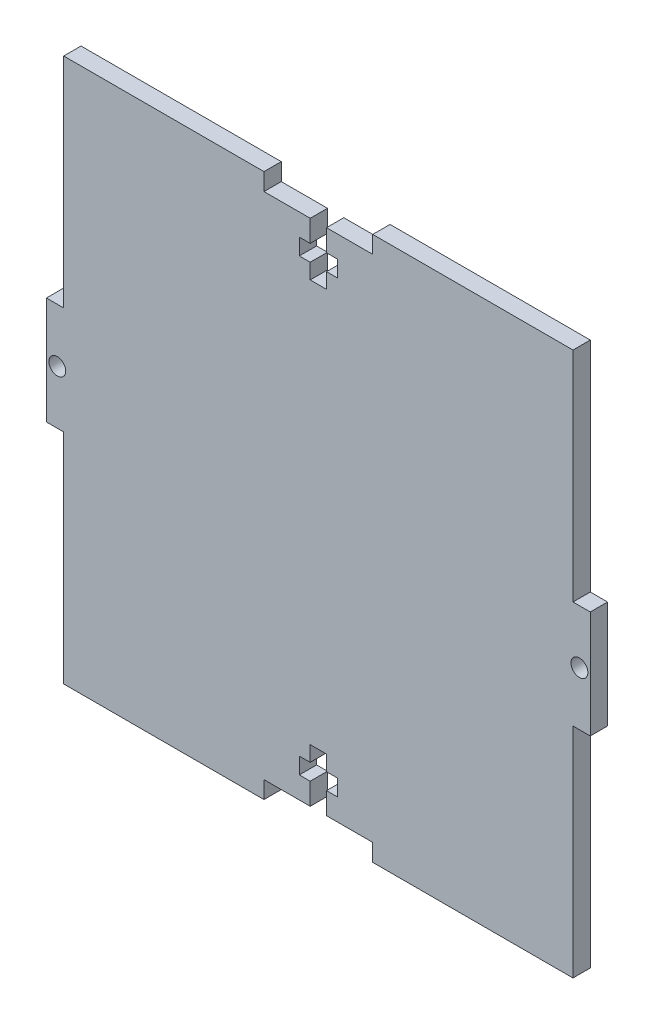
from build123d import *

# Parameters (mm, degrees)
SKETCH1_W           = 100
SKETCH1_H           = 100
BOSS_EXTRUDE2_DEPTH = 3.18
SKETCH2_R           = 1.55
SKETCH2_W           = 3.18
SKETCH2_H           = 40.125
CUT_EXTRUDE1_DEPTH  = 71.782147467


with BuildPart() as part:
    # Sketch1 → Boss-Extrude2 (new body)
    with BuildSketch(Plane.XY):
        Rectangle(SKETCH1_W, SKETCH1_H)
    extrude(amount=BOSS_EXTRUDE2_DEPTH)

    # Sketch2 → Cut-Extrude1 (cut, through all)
    with BuildSketch(Plane.XY.offset(3.18)):
        with Locations((-48, 0)):
            Circle(SKETCH2_R)
        Polygon((-10, 50), (-10, 46.82), (-1.5, 46.82), (-1.5, 42.82), (-3.5, 42.82), (-3.5, 39.82), (-1.5, 39.82), (-1.5, 37), (1.5, 37), (1.5, 39.82), (3.5, 39.82), (3.5, 42.82), (1.5, 42.82), (1.5, 46.82), (10, 46.82), (10, 50), align=None)
        with Locations((-48.41, 29.9375)):
            Rectangle(SKETCH2_W, SKETCH2_H)
        with Locations((-48.41, -29.9375)):
            Rectangle(SKETCH2_W, SKETCH2_H)
    cut_extrude1 = extrude(amount=-CUT_EXTRUDE1_DEPTH, mode=Mode.SUBTRACT)

    # Mirror1: Cut-Extrude1 across plane
    add(cut_extrude1.mirror(Plane.ZX), mode=Mode.SUBTRACT)

    # Mirror3: Cut-Extrude1 across plane
    add(cut_extrude1.mirror(Plane(origin=(0, 0, 0), x_dir=(0, 0, 1), z_dir=(1, 0, 0))), mode=Mode.SUBTRACT)


solid = part.part
